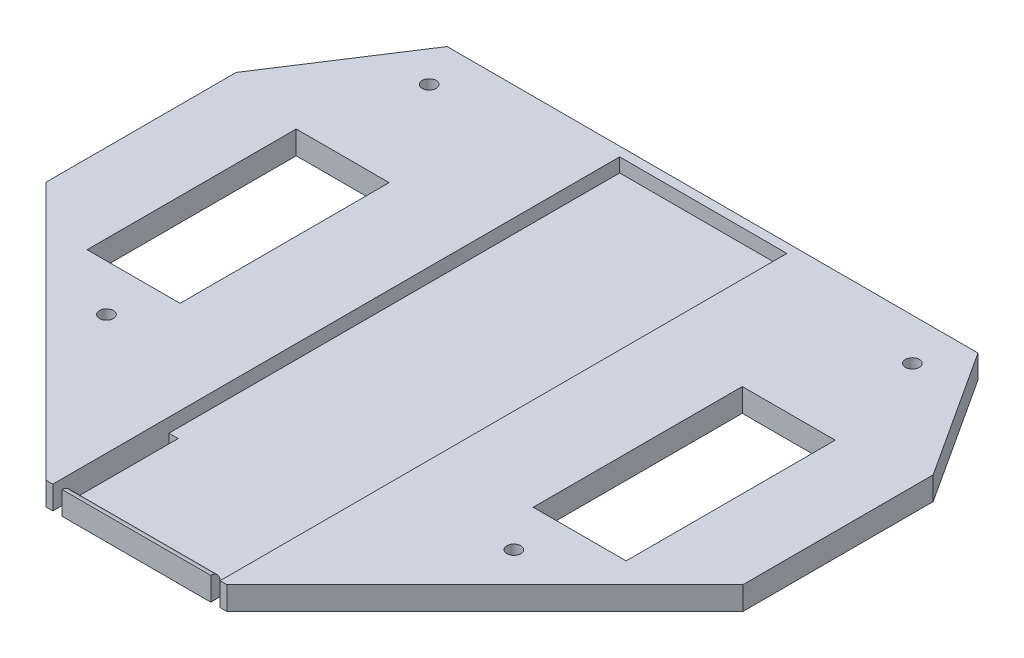
from build123d import *

# Parameters (mm, degrees)
BOSS_EXTRUDE1_DEPTH          = 5
F_3_0_3_DIAMETER_HOLE1_D     = 3
F_3_0_3_DIAMETER_HOLE1_DEPTH = 6
F_3_0_3_DIAMETER_HOLE1_TIP   = 0.901290929
SKETCH6_W                    = 36
SKETCH6_H                    = 120
CUT_EXTRUDE1_DEPTH           = 3
SKETCH9_W                    = 20
SKETCH9_H                    = 45
CUT_EXTRUDE3_DEPTH           = 172.404214254
SKETCH10_W                   = 2
SKETCH10_H                   = 25
CUT_EXTRUDE4_DEPTH           = 172.404214254
FILLET3_R                    = 2


with BuildPart() as part:
    # Sketch3 → Boss-Extrude1 (new body)
    with BuildSketch(Plane(origin=(0, 0, 0), x_dir=(1, 0, 0), z_dir=(0, 1, 0))):
        Polygon((32.540994622, -115.001759396), (71.460246245, -115.001759396), (127, -59.462005641), (127, -18.529510204), (109.123269601, 8.998240604), (-5.122028734, 8.998240604), (-23, -18.531420972), (-23, -59.460764774), align=None)
    extrude(amount=BOSS_EXTRUDE1_DEPTH)

    # Ø3.0 (3) Diameter Hole1
    with Locations(Plane(origin=(0, 5, 0), x_dir=(1, 0, 0), z_dir=(0, 1, 0))):
        with Locations((95.841240867, -77.61), (8.16, -77.61), (103.998195646, -0.001759396), (0.003045221, -0.001759396)):
            Hole(F_3_0_3_DIAMETER_HOLE1_D / 2, depth=F_3_0_3_DIAMETER_HOLE1_DEPTH)
            with Locations((0, 0, -(F_3_0_3_DIAMETER_HOLE1_DEPTH + F_3_0_3_DIAMETER_HOLE1_TIP / 2))):  # 118° drill point
                Cone(0, F_3_0_3_DIAMETER_HOLE1_D / 2, F_3_0_3_DIAMETER_HOLE1_TIP, mode=Mode.SUBTRACT)

    # Sketch6 → Cut-Extrude1 (cut)
    with BuildSketch(Plane(origin=(0, 5, 0), x_dir=(1, 0, 0), z_dir=(0, 1, 0))):
        with Locations((52, -53.001759396)):
            Rectangle(SKETCH6_W, SKETCH6_H)
    extrude(amount=-CUT_EXTRUDE1_DEPTH, mode=Mode.SUBTRACT)

    # Sketch9 → Cut-Extrude3 (cut, through all)
    with BuildSketch(Plane(origin=(0, 5, 0), x_dir=(1, 0, 0), z_dir=(0, 1, 0))):
        with Locations((4, -45.11)):
            Rectangle(SKETCH9_W, SKETCH9_H)
    cut_extrude3 = extrude(amount=-CUT_EXTRUDE3_DEPTH, mode=Mode.SUBTRACT)

    # Mirror1: Cut-Extrude3 across plane
    add(cut_extrude3.mirror(Plane(origin=(52, 0, 0), x_dir=(0, 0, 1), z_dir=(1, 0, 0))), mode=Mode.SUBTRACT)

    # Sketch10 → Cut-Extrude4 (cut, through all)
    with BuildSketch(Plane(origin=(0, 5, 0), x_dir=(1, 0, 0), z_dir=(0, 1, 0))):
        with Locations((35, -102.501759396)):
            Rectangle(SKETCH10_W, SKETCH10_H)
        with Locations((69, -102.501759396)):
            Rectangle(SKETCH10_W, SKETCH10_H)
    extrude(amount=-CUT_EXTRUDE4_DEPTH, mode=Mode.SUBTRACT)

    # Fillet3
    fillet3_edges = [part.edges().sort_by_distance(p)[0] for p in [
        (52, 5, 113.001759396),
    ]]
    fillet(fillet3_edges, radius=FILLET3_R - 0.0001)  # a hair under: the kernel refuses the full size


solid = part.part
